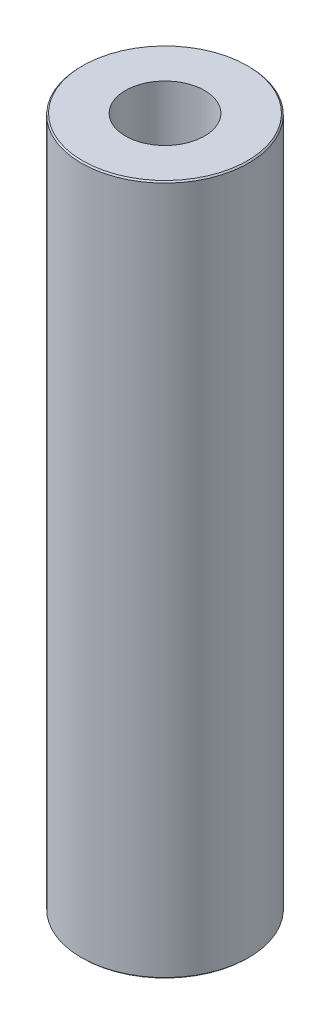
from build123d import *

# Parameters (mm, degrees)
SKETCH1_R           = 60
BOSS_EXTRUDE1_DEPTH = 494.98993203
SKETCH2_R           = 28.333598425
CUT_EXTRUDE1_DEPTH  = 503.210148057
CHAMFER1_SIZE       = 0.959094036


with BuildPart() as part:
    # Sketch1 → Boss-Extrude1 (new body)
    with BuildSketch(Plane(origin=(0, 0, 0), x_dir=(1, 0, 0), z_dir=(0, 1, 0))):
        Circle(SKETCH1_R)
    extrude(amount=BOSS_EXTRUDE1_DEPTH)

    # Sketch2 → Cut-Extrude1 (cut, through all)
    with BuildSketch(Plane(origin=(0, 0, 0), x_dir=(1, 0, 0), z_dir=(0, 1, 0))):
        Circle(SKETCH2_R)
    extrude(amount=CUT_EXTRUDE1_DEPTH, mode=Mode.SUBTRACT)

    # Chamfer1
    chamfer1_edges = [part.edges().sort_by_distance(p)[0] for p in [
        (-60, 494.98993203, 0),
        (-60, 0, 0),
    ]]
    chamfer(chamfer1_edges, length=CHAMFER1_SIZE)


solid = part.part
